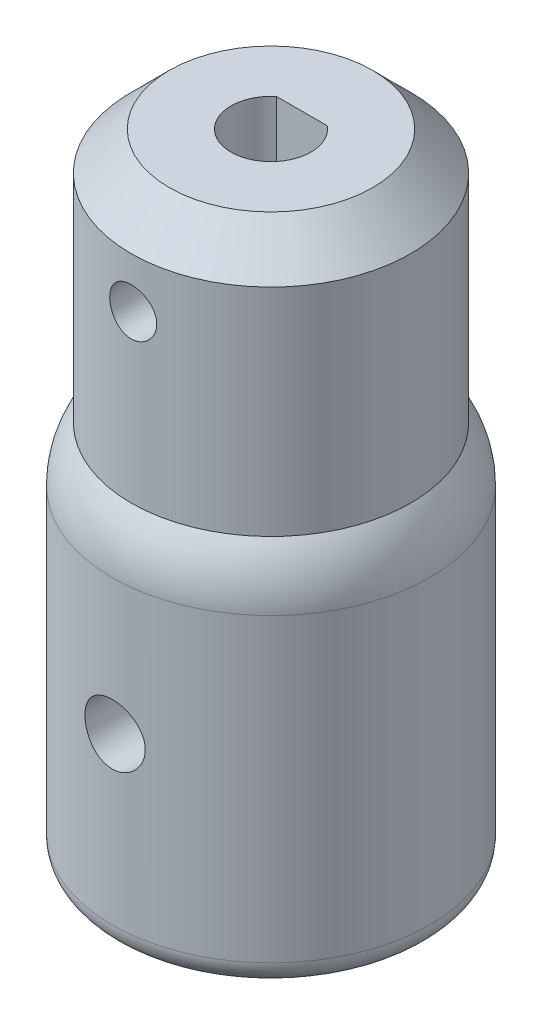
from build123d import *

# Parameters (mm, degrees)
SKETCH1_R           = 11
SKETCH1_R_2         = 7.7
BOSS_EXTRUDE1_DEPTH = 30
BOSS_EXTRUDE2_START = 30
SKETCH1_2_R         = 11
SKETCH1_2_R_2       = 7.7
BOSS_EXTRUDE2_DEPTH = 5
BOSS_EXTRUDE3_START = 35
SKETCH1_4_R         = 11
SKETCH1_4_R_2       = 7.7
SKETCH1_4_R_3       = 3.15
BOSS_EXTRUDE3_DEPTH = 15
SKETCH1_5_R         = 12.5
SKETCH1_5_R_2       = 11
BOSS_EXTRUDE4_DEPTH = 30
SKETCH2_R           = 1.85
CUT_EXTRUDE1_DEPTH  = 58.282196187
SKETCH2_7_R         = 2.371596242
CUT_EXTRUDE2_DEPTH  = 4
SKETCH2_8_R         = 2.371596242
CUT_EXTRUDE3_DEPTH  = 58.282196274
FILLET1_R           = 7
FILLET2_R           = 2
CHAMFER1_SIZE       = 3


with BuildPart() as part:
    # Sketch1 → Boss-Extrude1 (new body)
    with BuildSketch(Plane(origin=(0, 0, 0), x_dir=(1, 0, 0), z_dir=(0, 1, 0))):
        with Locations(Location((0, 0, 0), (0, 0, 270))):
            Circle(SKETCH1_R)
        with Locations(Location((0, 0, 0), (0, 0, 270))):
            Circle(SKETCH1_R_2, mode=Mode.SUBTRACT)
    extrude(amount=BOSS_EXTRUDE1_DEPTH)

    # Sketch1<2> → Boss-Extrude2 (add)
    # profile 1 of 6: a face of its own
    with BuildSketch(Plane(origin=(0, 0, 0), x_dir=(1, 0, 0), z_dir=(0, 1, 0)).offset(BOSS_EXTRUDE2_START)):
        with Locations(Location((0, 0, 0), (0, 0, 270))):
            Circle(SKETCH1_2_R)
        with Locations(Location((0, 0, 0), (0, 0, 270))):
            Circle(SKETCH1_2_R_2, mode=Mode.SUBTRACT)
    # profile 2 of 6: a face of its own
    with BuildSketch(Plane(origin=(0, 0, 0), x_dir=(1, 0, 0), z_dir=(0, 1, 0)).offset(BOSS_EXTRUDE2_START)):
        with Locations(Location((0, 0, 0), (0, 0, 270))):
            Circle(SKETCH1_2_R_2)
    # profile 3 of 6: a face of its own
    with BuildSketch(Plane(origin=(0, 0, 0), x_dir=(1, 0, 0), z_dir=(0, 1, 0)).offset(BOSS_EXTRUDE2_START)):
        with BuildLine():
            ThreePointArc((2, 2.433618705), (0, 3.15), (-2, 2.433618705))
            Line((-2, 2.433618705), (2, 2.433618705))
        make_face()
    # profile 4 of 6: a face of its own
    with BuildSketch(Plane(origin=(0, 0, 0), x_dir=(1, 0, 0), z_dir=(0, 1, 0)).offset(BOSS_EXTRUDE2_START)):
        with BuildLine():
            Line((2, 2.433618705), (-2, 2.433618705))
            ThreePointArc((-2, 2.433618705), (-1.345826883, -2.848025632), (3.15, 0))
            ThreePointArc((3.15, 0), (2.848025632, 1.345826883), (2, 2.433618705))
        make_face()
    # profile 5 of 6: a face of its own
    with BuildSketch(Plane(origin=(0, 0, 0), x_dir=(1, 0, 0), z_dir=(0, 1, 0)).offset(BOSS_EXTRUDE2_START)):
        with BuildLine():
            ThreePointArc((2, 2.433618705), (0, 3.15), (-2, 2.433618705))
            Line((-2, 2.433618705), (2, 2.433618705))
        make_face()
    # profile 6 of 6: a face of its own
    with BuildSketch(Plane(origin=(0, 0, 0), x_dir=(1, 0, 0), z_dir=(0, 1, 0)).offset(BOSS_EXTRUDE2_START)):
        with BuildLine():
            Line((2, 2.433618705), (-2, 2.433618705))
            ThreePointArc((-2, 2.433618705), (-1.345826883, -2.848025632), (3.15, 0))
            ThreePointArc((3.15, 0), (2.848025632, 1.345826883), (2, 2.433618705))
        make_face()
    extrude(amount=BOSS_EXTRUDE2_DEPTH)

    # Sketch1<4> → Boss-Extrude3 (add)
    # profile 1 of 3: a face of its own
    with BuildSketch(Plane(origin=(0, 0, 0), x_dir=(1, 0, 0), z_dir=(0, 1, 0)).offset(BOSS_EXTRUDE3_START)):
        with Locations(Location((0, 0, 0), (0, 0, 270))):
            Circle(SKETCH1_4_R)
        with Locations(Location((0, 0, 0), (0, 0, 270))):
            Circle(SKETCH1_4_R_2, mode=Mode.SUBTRACT)
    # profile 2 of 3: a face of its own
    with BuildSketch(Plane(origin=(0, 0, 0), x_dir=(1, 0, 0), z_dir=(0, 1, 0)).offset(BOSS_EXTRUDE3_START)):
        with Locations(Location((0, 0, 0), (0, 0, 270))):
            Circle(SKETCH1_4_R_2)
        Circle(SKETCH1_4_R_3, mode=Mode.SUBTRACT)
    # profile 3 of 3: a face of its own
    with BuildSketch(Plane(origin=(0, 0, 0), x_dir=(1, 0, 0), z_dir=(0, 1, 0)).offset(BOSS_EXTRUDE3_START)):
        with BuildLine():
            ThreePointArc((2, 2.433618705), (0, 3.15), (-2, 2.433618705))
            Line((-2, 2.433618705), (2, 2.433618705))
        make_face()
    extrude(amount=BOSS_EXTRUDE3_DEPTH)

    # Sketch1<5> → Boss-Extrude4 (add)
    with BuildSketch(Plane(origin=(0, 0, 0), x_dir=(1, 0, 0), z_dir=(0, 1, 0))):
        with Locations(Location((0, 0, 0), (0, 0, 270))):
            Circle(SKETCH1_5_R)
        with Locations(Location((0, 0, 0), (0, 0, 270))):
            Circle(SKETCH1_5_R_2, mode=Mode.SUBTRACT)
    extrude(amount=BOSS_EXTRUDE4_DEPTH)

    # Sketch2 → Cut-Extrude1 (cut, through all)
    with BuildSketch(Plane(origin=(0, 0, -12.5), x_dir=(-1, 0, 0), z_dir=(0, 0, -1))):
        with Locations(Location((0, 43.042161893, 0), (0, 0, 90))):
            Circle(SKETCH2_R)
    extrude(amount=-CUT_EXTRUDE1_DEPTH, mode=Mode.SUBTRACT)

    # Sketch2<7> → Cut-Extrude2 (cut)
    # profile 1 of 2: a face of its own
    with BuildSketch(Plane(origin=(0, 0, -12.5), x_dir=(-1, 0, 0), z_dir=(0, 0, -1))):
        Polygon((-2.107328483, 11.35), (2.107328483, 11.35), (4.214656965, 15), (2.107328483, 18.65), (-2.107328483, 18.65), (-4.214656965, 15), align=None)
        with Locations((0, 15)):
            Circle(SKETCH2_7_R, mode=Mode.SUBTRACT)
    # profile 2 of 2: a face of its own
    with BuildSketch(Plane(origin=(0, 0, -12.5), x_dir=(-1, 0, 0), z_dir=(0, 0, -1))):
        with Locations((0, 15)):
            Circle(SKETCH2_7_R)
    extrude(amount=-CUT_EXTRUDE2_DEPTH, mode=Mode.SUBTRACT)

    # Sketch2<8> → Cut-Extrude3 (cut, through all)
    with BuildSketch(Plane(origin=(0, 0, -12.5), x_dir=(-1, 0, 0), z_dir=(0, 0, -1))):
        with Locations((0, 15)):
            Circle(SKETCH2_8_R)
    extrude(amount=-CUT_EXTRUDE3_DEPTH, mode=Mode.SUBTRACT)

    # Fillet1
    # the kernel refuses this fillet: 7 mm, written as the material it takes off along each edge
    with BuildSketch(Plane(origin=(0, 30, 0), x_dir=(0, 0, 1), z_dir=(-1, 0, 0))) as fillet1_piece_1:
        with BuildLine():
            CenterArc((5.5, -4.330127019), FILLET1_R, 0, 38.213210702)
            Line((12.5, -4.330127019), (12.64, -4.330127019))
            Line((12.64, -4.330127019), (12.64, 0))
            Line((12.64, 0), (12.5, 0.14))
            ThreePointArc((12.5, 0.14), (11.75, 0.14), (11.11, 0.08660254))
            Line((11.11, 0.08660254), (11, 0))
        make_face()
    revolve(axis=Axis((0, 30, 0), (0, 1, 0)), mode=Mode.SUBTRACT)

    # Fillet2
    fillet2_edges = [part.edges().sort_by_distance(p)[0] for p in [
        (0, 0, -12.5),
        (0, 0, -7.7),
    ]]
    fillet(fillet2_edges, radius=FILLET2_R)

    # Chamfer1
    chamfer1_edges = [part.edges().sort_by_distance(p)[0] for p in [
        (0, 50, -11),
    ]]
    chamfer(chamfer1_edges, length=CHAMFER1_SIZE)


solid = part.part
